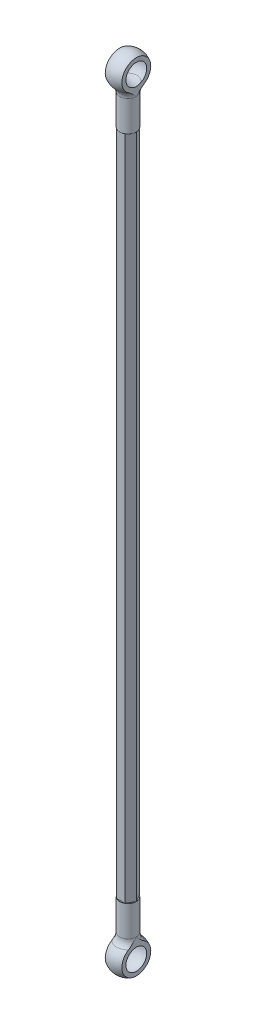
from build123d import *

# Parameters (mm, degrees)
BOSS_EXTRUDE1_DEPTH    = 100
FILLET1_R              = 3
CUT_EXTRUDE1_START     = 9.190524881
CUT_EXTRUDE1_OUTLINE_W = 3.5
CUT_EXTRUDE1_OUTLINE_H = 12
CUT_EXTRUDE1_DEPTH     = 10.139602238


# Read off the part's stored shape, not the designer's step: Cut-Extrude1, Shell1
with BuildPart() as part:
    # Sketch9 → Boss-Extrude1 (new body)
    with BuildSketch(Plane(origin=(0, 0, 0), x_dir=(-1, 0, 0), z_dir=(0, 1, 0))):
        Polygon((2.5, 0), (1.25, 2.165063509), (-1.25, 2.165063509), (-2.5, 0), (-1.25, -2.165063509), (1.25, -2.165063509), align=None)
    extrude(amount=-BOSS_EXTRUDE1_DEPTH)


with BuildPart() as body_2:
    # Sketch11 → Revolve1 (revolve)
    with BuildSketch(Plane.YZ):
        with BuildLine():
            Line((-100, 0), (-120, 0))
            ThreePointArc((-120, 0), (-116.294095226, 4.829629131), (-110.669872981, 2.5))
            Line((-110.669872981, 2.5), (-100, 2.5))
            Line((-100, 2.5), (-100, 0))
        make_face()
    revolve(axis=Axis((0, -100, 0), (0, -1, 0)))

    # Fillet1
    fillet1_edges = [body_2.edges().sort_by_distance(p)[0] for p in [
        (0, -110.669872981, -2.5),
    ]]
    fillet(fillet1_edges, radius=FILLET1_R)

    # Cut-Extrude1 outline → Cut-Extrude1 (cut)
    with BuildSketch(Plane.XZ.offset(100).offset(CUT_EXTRUDE1_START)):
        with Locations((4.25, 0)):
            Rectangle(CUT_EXTRUDE1_OUTLINE_W, CUT_EXTRUDE1_OUTLINE_H)
        with Locations((-4.25, 0)):
            Rectangle(CUT_EXTRUDE1_OUTLINE_W, CUT_EXTRUDE1_OUTLINE_H)
    extrude(amount=CUT_EXTRUDE1_DEPTH, mode=Mode.SUBTRACT)

    # Shell1 outline → Shell1 (revolve, cut)
    with BuildSketch(Plane.XY):
        with BuildLine():
            Line((1.5, -101), (0, -101))
            Line((0, -101), (0, -119))
            ThreePointArc((0, -119), (3.7161102, -116.480042223), (2.749999999, -112.09526249))
            ThreePointArc((2.749999999, -112.09526249), (1.825765386, -110.771663812), (1.5, -109.190524981))
            Line((1.5, -109.190524981), (1.5, -101))
        make_face()
    revolve(axis=Axis((0, 0, 0), (0, 1, 0)), mode=Mode.SUBTRACT)


with BuildPart() as body_3:
    # Mirror1: mirrored copy
    add(body_2.part.mirror(Plane.ZX))


with BuildPart() as body_4:
    # Mirror1 2: mirrored copy
    add(part.part.mirror(Plane.ZX))

    # Combine1: union part
    add(part.part)


solid = Compound([body_2.part, body_3.part, body_4.part])
